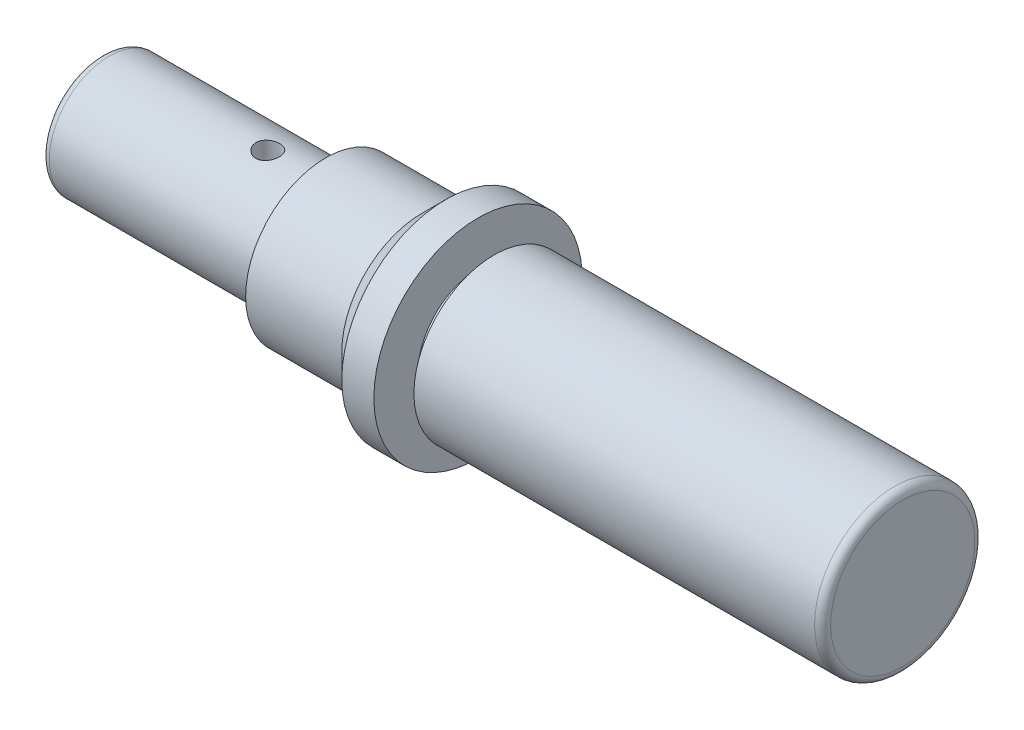
from build123d import *

# Parameters (mm, degrees)
FILLET1_R             = 1
F_1_0MM_DOWEL_HOLE1_D = 3


with BuildPart() as part:
    # Sketch1 → Revolve1 (revolve)
    with BuildSketch(Plane.XY):
        Polygon((-61.69976402, 9.89779966), (-61.69976402, 17.39779966), (-33.69976402, 17.39779966), (-33.69976402, 19.89779966), (-21.69976402, 19.89779966), (-18.69976402, 22.89779966), (-14.69976402, 22.89779966), (-14.69976402, 17.39779966), (-12.69976402, 17.39779966), (-12.69976402, 19.89779966), (38.30023598, 19.89779966), (38.30023598, 9.89779966), align=None)
    revolve(axis=Axis((-61.69976402, 9.89779966, 0), (1, 0, 0)))

    # Fillet1
    fillet1_edges = [part.edges().sort_by_distance(p)[0] for p in [
        (38.30023598, -0.10220034, 0),
        (-61.69976402, 2.39779966, 0),
    ]]
    fillet(fillet1_edges, radius=FILLET1_R)

    # Ø1.0mm Dowel Hole1 (through all)
    with Locations(Plane(origin=(-40.69976402, 17.394100447, 0.235530283), x_dir=(0, -0.031404037689, 0.999506771571), z_dir=(0, 0.999506771571, 0.031404037689))):
        with Locations((0, 0)):
            Hole(F_1_0MM_DOWEL_HOLE1_D / 2)


solid = part.part
